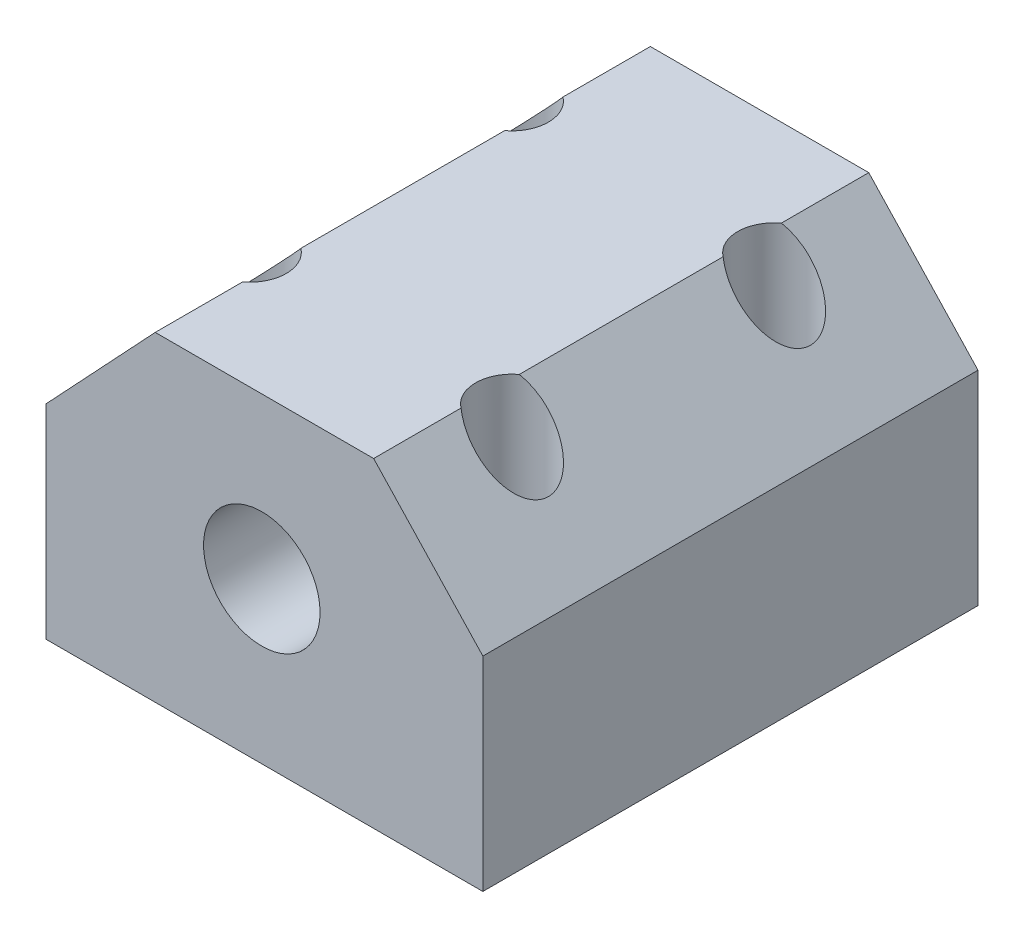
from build123d import *

# Parameters (mm, degrees)
SKETCH1_W           = 30
SKETCH1_H           = 34
BOSS_EXTRUDE1_DEPTH = 22
CUT_EXTRUDE1_REACH  = 52.398
SKETCH2_R           = 4
SKETCH3_R           = 2.5
CUT_EXTRUDE2_DEPTH  = 22


with BuildPart() as part:
    # Sketch1 → Boss-Extrude1 (new body)
    with BuildSketch(Plane(origin=(0, 0, 0), x_dir=(1, 0, 0), z_dir=(0, 1, 0))):
        with Locations((15, 17)):
            Rectangle(SKETCH1_W, SKETCH1_H)
    extrude(amount=BOSS_EXTRUDE1_DEPTH)

    # Sketch2 → Cut-Extrude1 (cut, up to next)
    with BuildSketch(Plane.XY, mode=Mode.PRIVATE) as cut_extrude1_sk1:
        with Locations((14.820555819, 11)):
            Circle(SKETCH2_R)
    cut_extrude1_tool1 = extrude(cut_extrude1_sk1.sketch, amount=-CUT_EXTRUDE1_REACH, mode=Mode.PRIVATE) & part.part
    # Sketch2 → Cut-Extrude1 (cut, up to next)
    with BuildSketch(Plane.XY, mode=Mode.PRIVATE) as cut_extrude1_sk2:
        Polygon((0, 14), (7.5, 22), (0, 22), align=None)
    cut_extrude1_tool2 = extrude(cut_extrude1_sk2.sketch, amount=-CUT_EXTRUDE1_REACH, mode=Mode.PRIVATE) & part.part
    # Sketch2 → Cut-Extrude1 (cut, up to next)
    with BuildSketch(Plane.XY, mode=Mode.PRIVATE) as cut_extrude1_sk3:
        Polygon((30, 14), (22.5, 22), (30, 22), align=None)
    cut_extrude1_tool3 = extrude(cut_extrude1_sk3.sketch, amount=-CUT_EXTRUDE1_REACH, mode=Mode.PRIVATE) & part.part
    add(cut_extrude1_tool1.solids().sort_by_distance((14.820556, 11, 0))[0], mode=Mode.SUBTRACT)
    add(cut_extrude1_tool2.solids().sort_by_distance((2.5, 19.333333, 0))[0], mode=Mode.SUBTRACT)
    add(cut_extrude1_tool3.solids().sort_by_distance((27.5, 19.333333, 0))[0], mode=Mode.SUBTRACT)

    # Sketch3 → Cut-Extrude2 (cut)
    with BuildSketch(Plane.XZ):
        with Locations((6, -8)):
            Circle(SKETCH3_R)
        with Locations((24, -8)):
            Circle(SKETCH3_R)
        with Locations((24, -26)):
            Circle(SKETCH3_R)
        with Locations((6, -26)):
            Circle(SKETCH3_R)
    extrude(amount=-CUT_EXTRUDE2_DEPTH, mode=Mode.SUBTRACT)


solid = part.part
